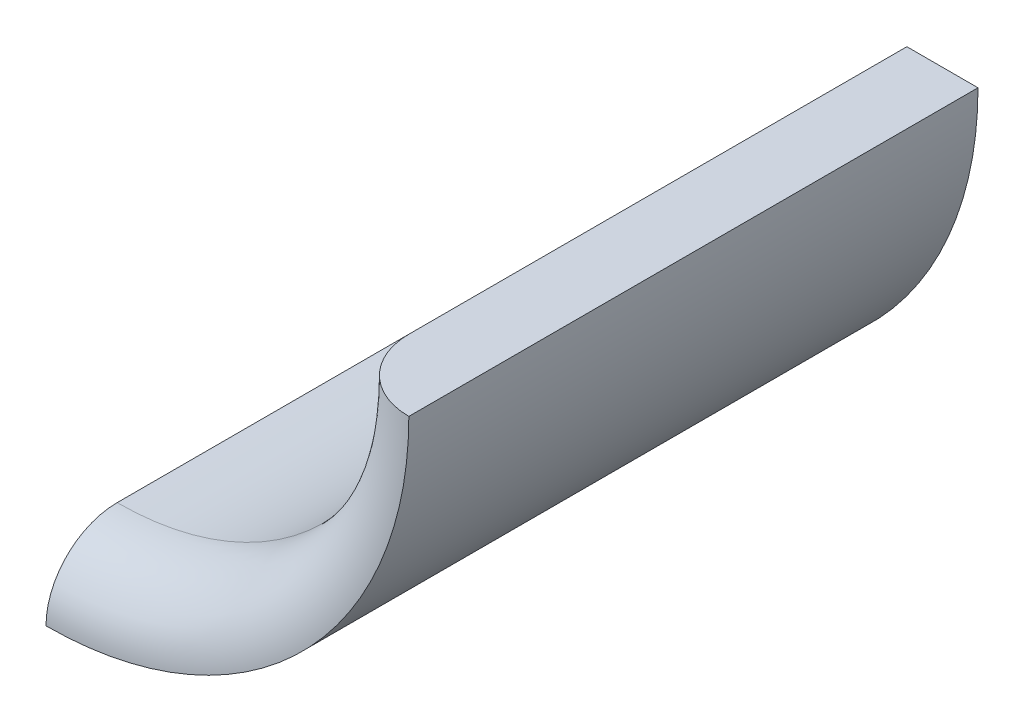
from build123d import *

# Parameters (mm, degrees)
SKETCH_1_R          = 510
SKETCH_1_R_2        = 410
EXTRUDE_1_DEPTH     = 800
FILLET_1_R          = 100
CUT_EXTRUDE_2_DEPTH = 800


with BuildPart() as part:
    # 草图1 → 凸台-拉伸1 (new body)
    with BuildSketch(Plane.XY):
        Circle(SKETCH_1_R)
        Circle(SKETCH_1_R_2, mode=Mode.SUBTRACT)
    extrude(amount=EXTRUDE_1_DEPTH)

    # 圆角1
    fillet_1_edges = [part.edges().sort_by_distance(p)[0] for p in [
        (-410, 0, 800),
    ]]
    fillet(fillet_1_edges, radius=FILLET_1_R - 0.0001)  # a hair under: the kernel refuses the full size

    # 草图2 → 切除-拉伸2 (cut)
    with BuildSketch(Plane.XY):
        Polygon((0, 764.183670641), (-976.361078065, 764.183670641), (-976.361078065, 0), (-976.361078065, -891.83511901), (0, -891.83511901), (0, 0), (1031.561704387, 0), (1031.561704387, 764.183670641), align=None)
    extrude(amount=CUT_EXTRUDE_2_DEPTH, mode=Mode.SUBTRACT)


solid = part.part
